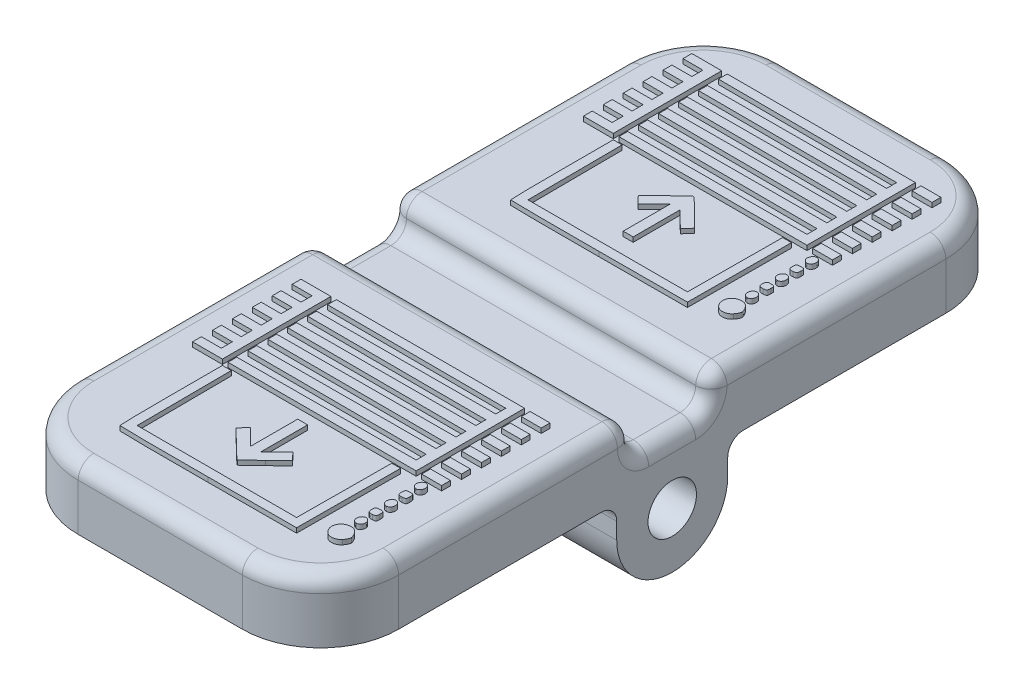
from build123d import *

# Parameters (mm, degrees)
SKETCH1_W           = 20.5
SKETCH1_H           = 45
BOSS_EXTRUDE1_DEPTH = 2.5
SKETCH2_W           = 20.5
SKETCH2_H           = 20
BOSS_EXTRUDE2_DEPTH = 2
FILLET1_R           = 1
FILLET2_R           = 5
SKETCH4_R           = 1.55
BOSS_EXTRUDE3_DEPTH = 20.5
CUT_EXTRUDE1_DEPTH  = 0.5
FILLET3_R           = 1
BOSS_EXTRUDE4_DEPTH = 0.3
BOSS_EXTRUDE5_DEPTH = 0.3


# Some blends are built 0.0001 mm under size
with BuildPart() as part:
    # Sketch1 → Boss-Extrude1 (new body)
    with BuildSketch(Plane(origin=(0, 0, 0), x_dir=(1, 0, 0), z_dir=(0, 1, 0))):
        with Locations((10.25, 22.5)):
            Rectangle(SKETCH1_W, SKETCH1_H)
    extrude(amount=BOSS_EXTRUDE1_DEPTH)

    # Sketch2 → Boss-Extrude2 (add)
    with BuildSketch(Plane(origin=(0, 2.5, 0), x_dir=(1, 0, 0), z_dir=(0, 1, 0))):
        with Locations((10.25, 35)):
            Rectangle(SKETCH2_W, SKETCH2_H)
        with Locations((10.25, 10)):
            Rectangle(SKETCH2_W, SKETCH2_H)
    extrude(amount=BOSS_EXTRUDE2_DEPTH)

    # Fillet1
    fillet1_edges = [part.edges().sort_by_distance(p)[0] for p in [
        (10.25, 2.5, -20),
        (10.25, 2.5, -25),
    ]]
    fillet(fillet1_edges, radius=FILLET1_R)
    fillet1_2_edges = [part.edges().sort_by_distance(p)[0] for p in [
        (0, 2.5, -22.5),
        (20.5, 2.5, -22.5),
        (0, 4.5, -10),
        (10.25, 4.5, 0),
        (20.5, 4.5, -10),
        (10.25, 4.5, -20),
        (10.25, 4.5, -25),
        (20.5, 4.5, -35),
        (10.25, 4.5, -45),
        (0, 4.5, -35),
        (20.5, 2.792893219, -20.292893219),
        (20.5, 2.792893219, -24.707106781),
        (0, 2.792893219, -24.707106781),
        (0, 2.792893219, -20.292893219),
    ]]
    fillet(fillet1_2_edges, radius=FILLET1_R - 0.0001)  # a hair under: the kernel refuses the full size

    # Fillet2
    # the kernel refuses this fillet: 5 mm, written as the material it takes off along each edge
    with BuildSketch(Plane(origin=(15.5, 4.5, -40), x_dir=(1, 0, 0), z_dir=(0, 0, 1))) as fillet2_piece_1:
        with BuildLine():
            CenterArc((4.0001, -0.9999), 0.9999, 0, 90)
            Line((5, -0.9999), (5, 0))
            Line((5, 0), (4.0001, 0))
        make_face()
    revolve(axis=Axis((15.5, 4.5, -40), (0, 1, 0)), revolution_arc=90, mode=Mode.SUBTRACT)
    with BuildSketch(Plane(origin=(15.5, 4.5, -5), x_dir=(0, 0, 1), z_dir=(-1, 0, 0))) as fillet2_piece_2:
        with BuildLine():
            CenterArc((4.0001, -0.9999), 0.9999, 0, 90)
            Line((5, -0.9999), (5, 0))
            Line((5, 0), (4.0001, 0))
        make_face()
    revolve(axis=Axis((15.5, 4.5, -5), (0, 1, 0)), revolution_arc=90, mode=Mode.SUBTRACT)
    with BuildSketch(Plane(origin=(5, 4.5, -40), x_dir=(0, 0, -1), z_dir=(1, 0, 0))) as fillet2_piece_3:
        with BuildLine():
            CenterArc((4.0001, -0.9999), 0.9999, 0, 90)
            Line((5, -0.9999), (5, 0))
            Line((5, 0), (4.0001, 0))
        make_face()
    revolve(axis=Axis((5, 4.5, -40), (0, 1, 0)), revolution_arc=90, mode=Mode.SUBTRACT)
    with BuildSketch(Plane(origin=(5, 4.5, -5), x_dir=(-1, 0, 0), z_dir=(0, 0, -1))) as fillet2_piece_4:
        with BuildLine():
            CenterArc((4.0001, -0.9999), 0.9999, 0, 90)
            Line((5, -0.9999), (5, 0))
            Line((5, 0), (4.0001, 0))
        make_face()
    revolve(axis=Axis((5, 4.5, -5), (0, 1, 0)), revolution_arc=90, mode=Mode.SUBTRACT)
    with BuildSketch(Plane(origin=(0, 4.5, 0), x_dir=(0, 0, -1), z_dir=(0, -1, 0)), Plane(origin=(20.5, -12.5, 0), x_dir=(0, 0, -1), z_dir=(0, 1, 0))) as fillet2_piece_5:
        with BuildLine():
            CenterArc((FILLET2_R, FILLET2_R), FILLET2_R, 180, 90)
            Line((0, FILLET2_R), (0, 0))
            Line((0, 0), (FILLET2_R, 0))
        make_face()
    extrude(amount=17, mode=Mode.SUBTRACT)
    with BuildSketch(Plane(origin=(0, 4.5, -45), x_dir=(0, 0, 1), z_dir=(0, -1, 0)), Plane(origin=(20.5, -12.5, -45), x_dir=(0, 0, 1), z_dir=(0, 1, 0))) as fillet2_piece_6:
        with BuildLine():
            CenterArc((FILLET2_R, -FILLET2_R), FILLET2_R, 90, 90)
            Line((0, -FILLET2_R), (0, 0))
            Line((0, 0), (FILLET2_R, 0))
        make_face()
    extrude(amount=17, mode=Mode.SUBTRACT)

    # Sketch4 → Boss-Extrude3 (add)
    with BuildSketch(Plane.ZY):
        with BuildLine():
            Line((-26.05, -1.55), (-26.05, 1.5))
            Line((-26.05, 1.5), (-18.95, 1.5))
            Line((-18.95, 1.5), (-18.95, -1.55))
            ThreePointArc((-18.95, -1.55), (-22.5, -5.1), (-26.05, -1.55))
        make_face()
        with Locations((-22.5, -1.55)):
            Circle(SKETCH4_R, mode=Mode.SUBTRACT)
    extrude(amount=-BOSS_EXTRUDE3_DEPTH)

    # Sketch10 → Cut-Extrude1 (cut)
    with BuildSketch(Plane.XZ):
        with BuildLine():
            Line((0, -18.95), (20.5, -18.95))
            Line((20.5, -18.95), (20.5, -5))
            ThreePointArc((20.5, -5), (19.035533906, -1.464466094), (15.5, 0))
            Line((15.5, 0), (5, 0))
            ThreePointArc((5, 0), (1.464466094, -1.464466094), (0, -5))
            Line((0, -5), (0, -18.95))
        make_face()
        with BuildLine():
            Line((20.5, -26.05), (0, -26.05))
            Line((0, -26.05), (0, -40))
            ThreePointArc((0, -40), (1.464466094, -43.535533906), (5, -45))
            Line((5, -45), (15.5, -45))
            ThreePointArc((15.5, -45), (19.035533906, -43.535533906), (20.5, -40))
            Line((20.5, -40), (20.5, -26.05))
        make_face()
    extrude(amount=-CUT_EXTRUDE1_DEPTH, mode=Mode.SUBTRACT)

    # Fillet3
    fillet3_edges = [part.edges().sort_by_distance(p)[0] for p in [
        (10.25, 0.5, -18.95),
        (10.25, 0.5, -26.05),
    ]]
    fillet(fillet3_edges, radius=FILLET3_R)

    # Sketch8 → Boss-Extrude4 (add)
    with BuildSketch(Plane(origin=(0, 4.5, 0), x_dir=(1, 0, 0), z_dir=(0, 1, 0))):
        Polygon((2.285398, 35.030293), (2.285398, 35.313476), (2.285398, 35.59666), (2.922567, 35.59666), (3.559735, 35.59666), (3.559735, 35.950646), (3.559735, 36.304632), (2.922567, 36.304632), (2.285398, 36.304632), (2.285398, 36.587815), (2.285398, 36.870999), (2.922567, 36.870999), (3.559735, 36.870999), (3.559735, 37.224985), (3.559735, 37.578971), (2.922567, 37.578971), (2.285398, 37.578971), (2.285398, 37.862155), (2.285398, 38.145338), (2.922567, 38.145338), (3.559735, 38.145338), (3.559735, 38.499324), (3.559735, 38.85331), (2.922567, 38.85331), (2.285398, 38.85331), (2.285398, 39.136494), (2.285398, 39.419677), (2.922567, 39.419677), (3.559735, 39.419677), (3.559735, 39.773663), (3.559735, 40.127623), (2.922567, 40.127623), (2.285398, 40.127623), (2.285398, 40.410806), (2.285398, 40.694016), (2.922567, 40.694016), (3.559735, 40.694016), (3.559735, 41.047976), (3.559735, 41.401962), (2.922567, 41.401962), (2.285398, 41.401962), (2.285398, 41.685146), (2.285398, 41.968329), (3.241149, 41.968329), (4.196903, 41.968329), (4.196903, 38.499324), (4.196903, 35.030293), (3.241149, 35.030293), align=None)
        Polygon((4.550886, 35.030293), (4.550886, 35.313053), (4.550886, 35.595813), (10.267700166, 35.614016501), (15.984512914, 35.632219997), (15.984512914, 35.950936997), (15.984512914, 36.269521997), (10.267698993, 36.287487), (4.550886, 36.305452), (4.550886, 36.587815), (4.550886, 36.870152), (10.267699, 36.888144), (15.984513263, 36.906136004), (15.984513263, 37.224588004), (15.984513263, 37.543173004), (10.267701499, 37.561548496), (4.550886, 37.579924), (4.550886, 37.862155), (4.550886, 38.144491), (10.267699, 38.162748), (15.984510743, 38.181004996), (15.984510743, 38.499721996), (15.984510743, 38.818306996), (10.267697282, 38.836152501), (4.550886, 38.853998), (4.550886, 39.136494), (4.550886, 39.418831), (10.267699, 39.437087), (15.984510746, 39.455342996), (15.984510746, 39.774033996), (15.984510746, 40.092618996), (10.267696909, 40.110610503), (4.550886, 40.128602), (4.550886, 40.410806), (4.550886, 40.69317), (10.267696897, 40.711029497), (15.984510726, 40.728889004), (15.984510726, 41.047580004), (15.984510726, 41.366165004), (10.267699, 41.384553), (4.550886, 41.402941), (4.550886, 41.685569), (4.550886, 41.968329), (10.568584, 41.968329), (16.586283, 41.968329), (16.586283, 38.499324), (16.586283, 35.030293), (10.568584, 35.030293), align=None)
        Polygon((16.940266, 41.401962), (16.940266, 41.685146), (16.940266, 41.968329), (17.577434, 41.968329), (18.214602, 41.968329), (18.214602, 41.685146), (18.214602, 41.401962), (17.577434, 41.401962), align=None)
        Polygon((16.940266, 40.127623), (16.940266, 40.410806), (16.940266, 40.694016), (17.577434, 40.694016), (18.214602, 40.694016), (18.214602, 40.410806), (18.214602, 40.127623), (17.577434, 40.127623), align=None)
        Polygon((16.940266, 38.85331), (16.940266, 39.136494), (16.940266, 39.419677), (17.577434, 39.419677), (18.214602, 39.419677), (18.214602, 39.136494), (18.214602, 38.85331), (17.577434, 38.85331), align=None)
        Polygon((16.940266, 37.578971), (16.940266, 37.862155), (16.940266, 38.145338), (17.577434, 38.145338), (18.214602, 38.145338), (18.214602, 37.862155), (18.214602, 37.578971), (17.577434, 37.578971), align=None)
        Polygon((16.940266, 36.304632), (16.940266, 36.587815), (16.940266, 36.870999), (17.577434, 36.870999), (18.214602, 36.870999), (18.214602, 36.587815), (18.214602, 36.304632), (17.577434, 36.304632), align=None)
        Polygon((16.940266, 35.030293), (16.940266, 35.313476), (16.940266, 35.59666), (17.577434, 35.59666), (18.214602, 35.59666), (18.214602, 35.313476), (18.214602, 35.030293), (17.577434, 35.030293), align=None)
        with BuildLine():
            add(Edge.make_bspline(
                [(17.577434, 34.039137), (17.509092, 34.039137), (17.414972, 34.085175), (17.368277, 34.141425)],
                knots=[0, 0, 0, 0, 1, 1, 1, 1], degree=3))
            add(Edge.make_bspline(
                [(17.368277, 34.141425), (17.166914, 34.384074), (17.444633, 34.794231), (17.701327, 34.633312)],
                knots=[0, 0, 0, 0, 1, 1, 1, 1], degree=3))
            add(Edge.make_bspline(
                [(17.701327, 34.633312), (17.953952, 34.474959), (17.863078, 34.039137), (17.577434, 34.039137)],
                knots=[0, 0, 0, 0, 1, 1, 1, 1], degree=3))
        make_face()
        with BuildLine():
            add(Edge.make_bspline(
                [(10.249999, 34.10994), (10.287813, 34.10994), (10.708966, 33.720658), (11.185893, 33.244884)],
                knots=[0, 0, 0, 0, 1, 1, 1, 1], degree=3))
            Line((11.185893, 33.244884), (12.053036, 32.379803))
            Line((12.053036, 32.379803), (11.826842, 32.14644))
            Line((11.826842, 32.14644), (11.6006485, 31.913077516))
            Line((11.6006485, 31.913077516), (11.084617402, 32.42565341))
            Line((11.084617402, 32.42565341), (10.568570791, 32.938244715))
            Line((10.568570791, 32.938244715), (10.568570791, 31.435569715))
            Line((10.568570791, 31.435569715), (10.568570791, 29.932928055))
            Line((10.568570791, 29.932928055), (10.250008947, 29.932928055))
            Line((10.250008947, 29.932928055), (9.931425947, 29.932928055))
            Line((9.931425947, 29.932928055), (9.931425947, 31.435576055))
            Line((9.931425947, 31.435576055), (9.931425947, 32.938251055))
            Line((9.931425947, 32.938251055), (9.415381747, 32.42565833))
            Line((9.415381747, 32.42565833), (8.899351047, 31.913079015))
            Line((8.899351047, 31.913079015), (8.673159, 32.14644))
            Line((8.673159, 32.14644), (8.446965, 32.379803))
            Line((8.446965, 32.379803), (9.314108, 33.244884))
            add(Edge.make_bspline(
                [(9.314108, 33.244884), (9.791035, 33.720658), (10.212185, 34.10994), (10.249999, 34.10994)],
                knots=[0, 0, 0, 0, 1, 1, 1, 1], degree=3))
        make_face()
        with BuildLine():
            add(Edge.make_bspline(
                [(17.594644, 33.13196), (17.440022, 33.117144), (17.350726, 33.144396), (17.323559, 33.215304)],
                knots=[0, 0, 0, 0, 1, 1, 1, 1], degree=3))
            add(Edge.make_bspline(
                [(17.323559, 33.215304), (17.301271, 33.27338), (17.293534, 33.394877), (17.306354, 33.485311)],
                knots=[0, 0, 0, 0, 1, 1, 1, 1], degree=3))
            add(Edge.make_bspline(
                [(17.306354, 33.485311), (17.325674, 33.621625), (17.37206, 33.64975), (17.577439, 33.64975)],
                knots=[0, 0, 0, 0, 1, 1, 1, 1], degree=3))
            add(Edge.make_bspline(
                [(17.577439, 33.64975), (17.813426, 33.649747368), (17.825226867, 33.637841236), (17.825224236, 33.401965236)],
                knots=[0, 0, 0, 0, 1, 1, 1, 1], degree=3))
            add(Edge.make_bspline(
                [(17.825224236, 33.401965236), (17.825221505, 33.174052236), (17.806731245, 33.152410458), (17.594644, 33.13196)],
                knots=[0, 0, 0, 0, 1, 1, 1, 1], degree=3))
        make_face()
        with BuildLine():
            add(Edge.make_bspline(
                [(17.577434, 32.127628), (17.509092, 32.127628), (17.414972, 32.173666), (17.368277, 32.229943)],
                knots=[0, 0, 0, 0, 1, 1, 1, 1], degree=3))
            add(Edge.make_bspline(
                [(17.368277, 32.229943), (17.166914, 32.472566), (17.444633, 32.882723), (17.701327, 32.721803)],
                knots=[0, 0, 0, 0, 1, 1, 1, 1], degree=3))
            add(Edge.make_bspline(
                [(17.701327, 32.721803), (17.953952, 32.56345), (17.863078, 32.127628), (17.577434, 32.127628)],
                knots=[0, 0, 0, 0, 1, 1, 1, 1], degree=3))
        make_face()
        with BuildLine():
            add(Edge.make_bspline(
                [(17.594644, 31.220451), (17.440022, 31.205635), (17.350726, 31.232887), (17.323559, 31.303795)],
                knots=[0, 0, 0, 0, 1, 1, 1, 1], degree=3))
            add(Edge.make_bspline(
                [(17.323559, 31.303795), (17.301271, 31.361871), (17.293534, 31.483368), (17.306354, 31.573803)],
                knots=[0, 0, 0, 0, 1, 1, 1, 1], degree=3))
            add(Edge.make_bspline(
                [(17.306354, 31.573803), (17.325674, 31.710116), (17.37206, 31.738241), (17.577439, 31.738241)],
                knots=[0, 0, 0, 0, 1, 1, 1, 1], degree=3))
            add(Edge.make_bspline(
                [(17.577439, 31.738241), (17.813426, 31.738238368), (17.825226867, 31.726332236), (17.825224236, 31.490456236)],
                knots=[0, 0, 0, 0, 1, 1, 1, 1], degree=3))
            add(Edge.make_bspline(
                [(17.825224236, 31.490456236), (17.825221505, 31.262544236), (17.806731245, 31.240901458), (17.594644, 31.220451)],
                knots=[0, 0, 0, 0, 1, 1, 1, 1], degree=3))
        make_face()
        with BuildLine():
            add(Edge.make_bspline(
                [(17.577434, 30.21612), (17.509092, 30.21612), (17.414972, 30.262157), (17.368277, 30.318434)],
                knots=[0, 0, 0, 0, 1, 1, 1, 1], degree=3))
            add(Edge.make_bspline(
                [(17.368277, 30.318434), (17.166914, 30.561057), (17.444633, 30.971214), (17.701327, 30.810294)],
                knots=[0, 0, 0, 0, 1, 1, 1, 1], degree=3))
            add(Edge.make_bspline(
                [(17.701327, 30.810294), (17.953952, 30.651941), (17.863078, 30.21612), (17.577434, 30.21612)],
                knots=[0, 0, 0, 0, 1, 1, 1, 1], degree=3))
        make_face()
        with BuildLine():
            add(Edge.make_bspline(
                [(18.031317, 28.876428), (17.80583, 28.608458), (17.411175, 28.574539), (17.166861, 28.80216)],
                knots=[0, 0, 0, 0, 1, 1, 1, 1], degree=3))
            add(Edge.make_bspline(
                [(17.166861, 28.80216), (16.7381, 29.201601), (16.998349, 29.862134), (17.58449, 29.862134)],
                knots=[0, 0, 0, 0, 1, 1, 1, 1], degree=3))
            add(Edge.make_bspline(
                [(17.58449, 29.862134), (17.791862, 29.862134), (17.887096, 29.815726), (18.031317, 29.644329)],
                knots=[0, 0, 0, 0, 1, 1, 1, 1], degree=3))
            add(Edge.make_bspline(
                [(18.031317, 29.644329), (18.132124, 29.524525), (18.214602, 29.351752), (18.214602, 29.260365)],
                knots=[0, 0, 0, 0, 1, 1, 1, 1], degree=3))
            add(Edge.make_bspline(
                [(18.214602, 29.260365), (18.214602, 29.169005), (18.132124, 28.996232), (18.031317, 28.876428)],
                knots=[0, 0, 0, 0, 1, 1, 1, 1], degree=3))
        make_face()
        with BuildLine():
            add(Edge.make_bspline(
                [(4.598504, 28.068206), (4.572308, 28.094399), (4.550886, 29.591941), (4.550886, 31.396082)],
                knots=[0, 0, 0, 0, 1, 1, 1, 1], degree=3))
            Line((4.550886, 31.396082), (4.550886, 34.676279045))
            Line((4.550886, 34.676279045), (4.833320151, 34.676279045))
            Line((4.833320151, 34.676279045), (5.115745151, 34.676279045))
            Line((5.115745151, 34.676279045), (5.134208151, 31.649736045))
            Line((5.134208151, 31.649736045), (5.152671145, 28.623194045))
            Line((5.152671145, 28.623194045), (10.250016145, 28.623194045))
            Line((10.250016145, 28.623194045), (15.347361145, 28.623194045))
            Line((15.347361145, 28.623194045), (15.365824145, 31.649736045))
            Line((15.365824145, 31.649736045), (15.384287151, 34.676279045))
            Line((15.384287151, 34.676279045), (15.667413151, 34.676279045))
            Line((15.667413151, 34.676279045), (15.950539151, 34.676279045))
            Line((15.950539151, 34.676279045), (15.932129151, 31.366553045))
            Line((15.932129151, 31.366553045), (15.913719006, 28.056801052))
            Line((15.913719006, 28.056801052), (10.279922, 28.038811))
            add(Edge.make_bspline(
                [(10.279922, 28.038811), (7.181333, 28.028651), (4.624695, 28.04188), (4.598504, 28.068206)],
                knots=[0, 0, 0, 0, 1, 1, 1, 1], degree=3))
        make_face()
    extrude(amount=BOSS_EXTRUDE4_DEPTH)

    # Sketch9 → Boss-Extrude5 (add)
    with BuildSketch(Plane(origin=(0, 4.5, 0), x_dir=(1, 0, 0), z_dir=(0, 1, 0))):
        with BuildLine():
            Line((4.550886, 6.396082), (4.550886, 9.676307))
            Line((4.550886, 9.676307), (4.833311, 9.676307))
            Line((4.833311, 9.676307), (5.115736, 9.676307))
            Line((5.115736, 9.676307), (5.134199003, 6.649764))
            Line((5.134199003, 6.649764), (5.152662006, 3.623221))
            Line((5.152662006, 3.623221), (10.250007006, 3.623221))
            Line((10.250007006, 3.623221), (15.347352006, 3.623221))
            Line((15.347352006, 3.623221), (15.365815009, 6.649764))
            Line((15.365815009, 6.649764), (15.384278012, 9.676307))
            Line((15.384278012, 9.676307), (15.667404006, 9.676307))
            Line((15.667404006, 9.676307), (15.95053, 9.676307))
            Line((15.95053, 9.676307), (15.932128604, 6.365952994))
            Line((15.932128604, 6.365952994), (15.913730554, 3.056200933))
            Line((15.913730554, 3.056200933), (10.279933554, 3.038208933))
            add(Edge.make_bspline(
                [(10.279933554, 3.038208933), (7.181340347, 3.028382062), (4.6247012, 3.041885948), (4.598513004, 3.068214791)],
                knots=[0, 0, 0, 0, 1, 1, 1, 1], degree=3))
            add(Edge.make_bspline(
                [(4.598513004, 3.068214791), (4.572317, 3.094407651), (4.550890949, 4.591945695), (4.550886, 6.396082)],
                knots=[0, 0, 0, 0, 1, 1, 1, 1], degree=3))
        make_face()
        with BuildLine():
            Line((10.568582046, 7.607285513), (10.568582046, 6.104637013))
            Line((10.568582046, 6.104637013), (11.08461479, 6.617213765))
            Line((11.08461479, 6.617213765), (11.600647533, 7.129790516))
            Line((11.600647533, 7.129790516), (11.826839487, 6.896426533))
            Line((11.826839487, 6.896426533), (12.053031441, 6.66306255))
            Line((12.053031441, 6.66306255), (11.185884651, 5.79798435))
            add(Edge.make_bspline(
                [(11.185884651, 5.79798435), (10.708958256, 5.322210743), (10.287808752, 4.932928207), (10.249994752, 4.932928159)],
                knots=[0, 0, 0, 0, 1, 1, 1, 1], degree=3))
            add(Edge.make_bspline(
                [(10.249994752, 4.932928159), (10.212179752, 4.932928475), (9.791031014, 5.322214004), (9.314108, 5.797991)],
                knots=[0, 0, 0, 0, 1, 1, 1, 1], degree=3))
            Line((9.314108, 5.797991), (8.446965, 6.663073))
            Line((8.446965, 6.663073), (8.673159, 6.896435))
            Line((8.673159, 6.896435), (8.899353, 7.129797))
            Line((8.899353, 7.129797), (9.415382523, 6.617217006))
            Line((9.415382523, 6.617217006), (9.931412046, 6.104637013))
            Line((9.931412046, 6.104637013), (9.931412046, 7.607285513))
            Line((9.931412046, 7.607285513), (9.931412046, 9.109934013))
            Line((9.931412046, 9.109934013), (10.249997046, 9.109934013))
            Line((10.249997046, 9.109934013), (10.568582046, 9.109934013))
            Line((10.568582046, 9.109934013), (10.568582046, 7.607285513))
        make_face()
        Polygon((2.285398, 10.313476), (2.285398, 10.596659), (2.922566, 10.596659), (3.559734, 10.596659), (3.559734, 10.9506455), (3.559734, 11.304632), (2.922566, 11.304632), (2.285398, 11.304632), (2.285398, 11.587815), (2.285398, 11.870998), (2.922566, 11.870998), (3.559734, 11.870998), (3.559734, 12.2249845), (3.559734, 12.578971), (2.922566, 12.578971), (2.285398, 12.578971), (2.285398, 12.862154), (2.285398, 13.145337), (2.922566, 13.145337), (3.559734, 13.145337), (3.559734, 13.4993235), (3.559734, 13.85331), (2.922566, 13.85331), (2.285398, 13.85331), (2.285398, 14.136493), (2.285398, 14.419676), (2.922566, 14.419676), (3.559734, 14.419676), (3.559734, 14.7736625), (3.559734, 15.127623), (2.922566, 15.127623), (2.285398, 15.127623), (2.285398, 15.410806), (2.285398, 15.694015), (2.922566, 15.694015), (3.559734, 15.694015), (3.559734, 16.0479755), (3.559734, 16.401962), (2.922566, 16.401962), (2.285398, 16.401962), (2.285398, 16.685145), (2.285398, 16.968328), (3.2411505, 16.968328), (4.196903, 16.968328), (4.196903, 13.499324), (4.196903, 10.030293), (3.2411505, 10.030293), (2.285398, 10.030293), align=None)
        Polygon((4.550886, 10.313066499), (4.550886, 10.595839999), (10.267699166, 10.613884499), (15.984512332, 10.631929), (15.984512332, 10.950646), (15.984512332, 11.269231), (10.267699166, 11.287275501), (4.550886, 11.305320001), (4.550886, 11.587815), (4.550886, 11.870152), (10.267699166, 11.888196501), (15.984512332, 11.906241001), (15.984512332, 12.225249999), (15.984512332, 12.543834999), (10.267699166, 12.561879499), (4.550886, 12.579924), (4.550886, 12.862180999), (4.550886, 13.144517999), (10.267699166, 13.162562499), (15.984512332, 13.180607), (15.984512332, 13.499324), (15.984512332, 13.817909), (10.267699166, 13.835953501), (4.550886, 13.853998001), (4.550886, 14.136519999), (4.550886, 14.418856999), (10.267699166, 14.436901499), (15.984512332, 14.454946), (15.984512332, 14.773637), (15.984512332, 15.092222), (10.267699166, 15.110266501), (4.550886, 15.128311001), (4.550886, 15.410701), (4.550886, 15.693195999), (10.267699166, 15.711240499), (15.984512332, 15.729285), (15.984512332, 16.047976), (15.984512332, 16.366561), (10.267699166, 16.384605501), (4.550886, 16.402650001), (4.550886, 16.685554501), (4.550886, 16.968328), (10.568582046, 16.968328), (16.586278093, 16.968328), (16.586278093, 13.499324), (16.586278093, 10.030293), (10.568582046, 10.030293), (4.550886, 10.030293), align=None)
        Polygon((16.940266, 10.313476), (16.940266, 10.596659), (17.577434, 10.596659), (18.214602, 10.596659), (18.214602, 10.313476), (18.214602, 10.030293), (17.577434, 10.030293), (16.940266, 10.030293), align=None)
        Polygon((16.940266, 11.587815), (16.940266, 11.870998), (17.577434, 11.870998), (18.214602, 11.870998), (18.214602, 11.587815), (18.214602, 11.304632), (17.577434, 11.304632), (16.940266, 11.304632), align=None)
        Polygon((16.940266, 12.862154), (16.940266, 13.145337), (17.577434, 13.145337), (18.214602, 13.145337), (18.214602, 12.862154), (18.214602, 12.578971), (17.577434, 12.578971), (16.940266, 12.578971), align=None)
        Polygon((16.940266, 14.136493), (16.940266, 14.419676), (17.577434, 14.419676), (18.214602, 14.419676), (18.214602, 14.136493), (18.214602, 13.85331), (17.577434, 13.85331), (16.940266, 13.85331), align=None)
        Polygon((16.940266, 15.410806), (16.940266, 15.694015), (17.577434, 15.694015), (18.214602, 15.694015), (18.214602, 15.410806), (18.214602, 15.127623), (17.577434, 15.127623), (16.940266, 15.127623), align=None)
        Polygon((16.940266, 16.685145), (16.940266, 16.968328), (17.577434, 16.968328), (18.214602, 16.968328), (18.214602, 16.685145), (18.214602, 16.401962), (17.577434, 16.401962), (16.940266, 16.401962), align=None)
        with BuildLine():
            add(Edge.make_bspline(
                [(17.166861, 3.80216), (16.7381, 4.201601), (16.998349, 4.862134), (17.58449, 4.862134)],
                knots=[0, 0, 0, 0, 1, 1, 1, 1], degree=3))
            add(Edge.make_bspline(
                [(17.58449, 4.862134), (17.791862, 4.862134), (17.887096, 4.815726), (18.031317, 4.644329)],
                knots=[0, 0, 0, 0, 1, 1, 1, 1], degree=3))
            add(Edge.make_bspline(
                [(18.031317, 4.644329), (18.132124, 4.524525), (18.214602, 4.351752), (18.214602, 4.260365)],
                knots=[0, 0, 0, 0, 1, 1, 1, 1], degree=3))
            add(Edge.make_bspline(
                [(18.214602, 4.260365), (18.214602, 4.169005), (18.132124, 3.996232), (18.031317, 3.876428)],
                knots=[0, 0, 0, 0, 1, 1, 1, 1], degree=3))
            add(Edge.make_bspline(
                [(18.031317, 3.876428), (17.80583, 3.608458), (17.411175, 3.574539), (17.166861, 3.80216)],
                knots=[0, 0, 0, 0, 1, 1, 1, 1], degree=3))
        make_face()
        with BuildLine():
            add(Edge.make_bspline(
                [(17.368277, 5.318434), (17.166914, 5.561057), (17.444633, 5.971214), (17.701327, 5.810294)],
                knots=[0, 0, 0, 0, 1, 1, 1, 1], degree=3))
            add(Edge.make_bspline(
                [(17.701327, 5.810294), (17.953952, 5.651941), (17.863078, 5.21612), (17.577434, 5.21612)],
                knots=[0, 0, 0, 0, 1, 1, 1, 1], degree=3))
            add(Edge.make_bspline(
                [(17.577434, 5.21612), (17.509092, 5.21612), (17.414972, 5.262157), (17.368277, 5.318434)],
                knots=[0, 0, 0, 0, 1, 1, 1, 1], degree=3))
        make_face()
        with BuildLine():
            add(Edge.make_bspline(
                [(17.323559, 6.303795), (17.301271, 6.361871), (17.293534, 6.483368), (17.306354, 6.573803)],
                knots=[0, 0, 0, 0, 1, 1, 1, 1], degree=3))
            add(Edge.make_bspline(
                [(17.306354, 6.573803), (17.325674, 6.710116), (17.37206, 6.738241), (17.577439, 6.738241)],
                knots=[0, 0, 0, 0, 1, 1, 1, 1], degree=3))
            add(Edge.make_bspline(
                [(17.577439, 6.738241), (17.813426, 6.738238368), (17.825226867, 6.726332236), (17.825224236, 6.490456236)],
                knots=[0, 0, 0, 0, 1, 1, 1, 1], degree=3))
            add(Edge.make_bspline(
                [(17.825224236, 6.490456236), (17.825221505, 6.262544236), (17.806731245, 6.240901458), (17.594644, 6.220451)],
                knots=[0, 0, 0, 0, 1, 1, 1, 1], degree=3))
            add(Edge.make_bspline(
                [(17.594644, 6.220451), (17.440022, 6.205635), (17.350726, 6.232887), (17.323559, 6.303795)],
                knots=[0, 0, 0, 0, 1, 1, 1, 1], degree=3))
        make_face()
        with BuildLine():
            add(Edge.make_bspline(
                [(17.368277, 7.229943), (17.166914, 7.472566), (17.444633, 7.882723), (17.701327, 7.721803)],
                knots=[0, 0, 0, 0, 1, 1, 1, 1], degree=3))
            add(Edge.make_bspline(
                [(17.701327, 7.721803), (17.953952, 7.56345), (17.863078, 7.127628), (17.577434, 7.127628)],
                knots=[0, 0, 0, 0, 1, 1, 1, 1], degree=3))
            add(Edge.make_bspline(
                [(17.577434, 7.127628), (17.509092, 7.127628), (17.414972, 7.173666), (17.368277, 7.229943)],
                knots=[0, 0, 0, 0, 1, 1, 1, 1], degree=3))
        make_face()
        with BuildLine():
            add(Edge.make_bspline(
                [(17.323559, 8.215304), (17.301271, 8.27338), (17.293534, 8.394877), (17.306354, 8.485311)],
                knots=[0, 0, 0, 0, 1, 1, 1, 1], degree=3))
            add(Edge.make_bspline(
                [(17.306354, 8.485311), (17.325674, 8.621625), (17.37206, 8.64975), (17.577439, 8.64975)],
                knots=[0, 0, 0, 0, 1, 1, 1, 1], degree=3))
            add(Edge.make_bspline(
                [(17.577439, 8.64975), (17.813426, 8.649747368), (17.825226867, 8.637841236), (17.825224236, 8.401965236)],
                knots=[0, 0, 0, 0, 1, 1, 1, 1], degree=3))
            add(Edge.make_bspline(
                [(17.825224236, 8.401965236), (17.825221505, 8.174052236), (17.806731245, 8.152410458), (17.594644, 8.13196)],
                knots=[0, 0, 0, 0, 1, 1, 1, 1], degree=3))
            add(Edge.make_bspline(
                [(17.594644, 8.13196), (17.440022, 8.117144), (17.350726, 8.144396), (17.323559, 8.215304)],
                knots=[0, 0, 0, 0, 1, 1, 1, 1], degree=3))
        make_face()
        with BuildLine():
            add(Edge.make_bspline(
                [(17.368277, 9.141425), (17.166914, 9.384074), (17.444633, 9.794231), (17.701327, 9.633312)],
                knots=[0, 0, 0, 0, 1, 1, 1, 1], degree=3))
            add(Edge.make_bspline(
                [(17.701327, 9.633312), (17.953952, 9.474959), (17.863078, 9.039137), (17.577434, 9.039137)],
                knots=[0, 0, 0, 0, 1, 1, 1, 1], degree=3))
            add(Edge.make_bspline(
                [(17.577434, 9.039137), (17.509092, 9.039137), (17.414972, 9.085175), (17.368277, 9.141425)],
                knots=[0, 0, 0, 0, 1, 1, 1, 1], degree=3))
        make_face()
    extrude(amount=BOSS_EXTRUDE5_DEPTH)


solid = part.part
